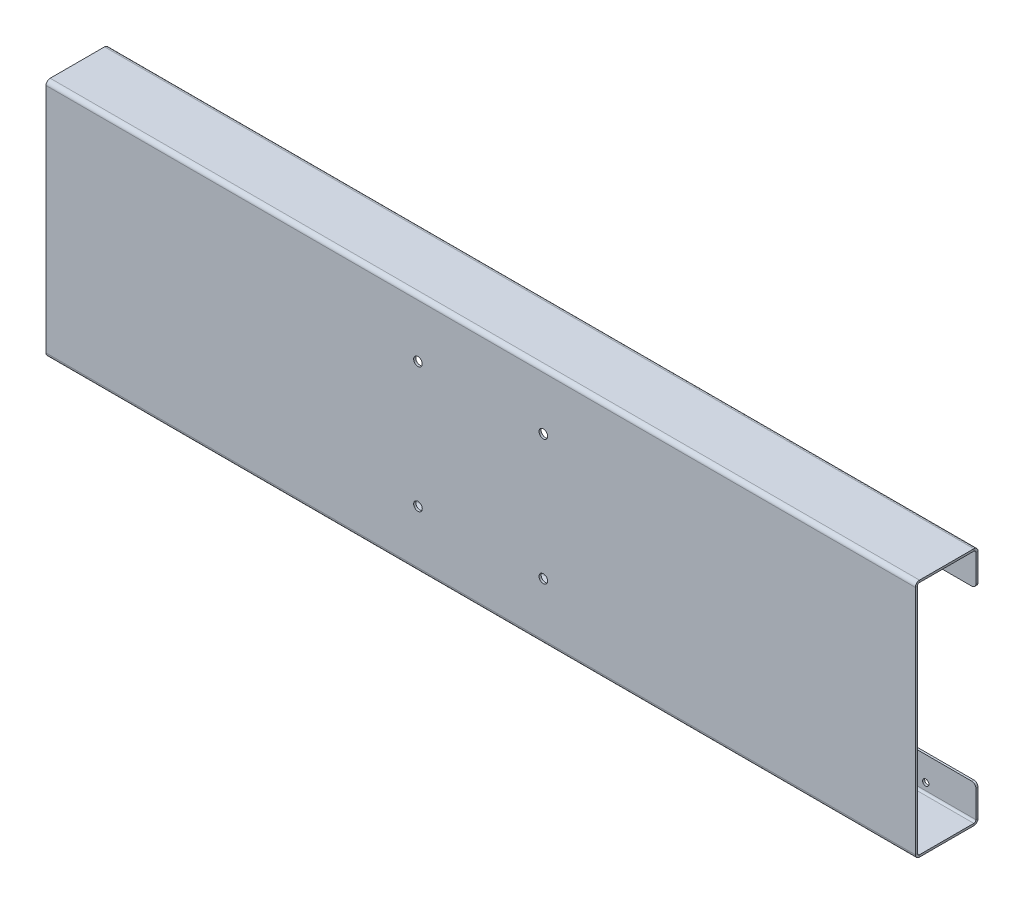
from build123d import *

# Parameters (mm, degrees)
SKETCH1_W                          = 660.4
SKETCH1_H                          = 179.07
BASE_FLANGE1_DEPTH                 = 1.5875
MITER_START                        = -330.2
MITER_FLANGE1_DEPTH                = 660.4
MITER_FLANGE1_2_DEPTH              = 660.4
F_3_16_0_1875_DIAMETER_HOLE1_D     = 4.7625
F_3_16_0_1875_DIAMETER_HOLE1_DEPTH = 5.1054
F_3_16_0_1875_DIAMETER_HOLE1_TIP   = 1.430799349
SKETCH25_R                         = 3.2639
CUT_EXTRUDE1_DEPTH                 = 346.837375989
FILLET1_R                          = 3.175


# Read off the part's stored shape, not the designer's step: Miter Flange1
# Sheet-metal steps are written as plain solids
with BuildPart() as part:
    # Sketch1 → Base-Flange1 (new body)
    with BuildSketch(Plane.XY):
        Rectangle(SKETCH1_W, SKETCH1_H)
    extrude(amount=-BASE_FLANGE1_DEPTH)

    # Miter Flange1 outline → Miter Flange1 (cut)
    with BuildSketch(Plane.YZ.offset(MITER_START)):
        with BuildLine():
            ThreePointArc((87.9475, 0), (88.769250468, -0.108185502), (89.535, -0.425369343))
            Line((89.535, -0.425369343), (89.535, 0))
            Line((89.535, 0), (87.9475, 0))
        make_face()
    miter_flange1 = extrude(amount=MITER_FLANGE1_DEPTH, mode=Mode.SUBTRACT)

    # Miter Flange1 2 outline → Miter Flange1 2 (add)
    with BuildSketch(Plane.YZ.offset(MITER_START)):
        with BuildLine():
            Line((87.9475, -46.0375), (64.135, -46.0375))
            Line((64.135, -46.0375), (64.135, -47.625))
            Line((64.135, -47.625), (87.9475, -47.625))
            ThreePointArc((87.9475, -47.625), (90.19256403, -46.69506403), (91.1225, -44.45))
            Line((91.1225, -44.45), (91.1225, -3.175))
            ThreePointArc((91.1225, -3.175), (90.697130657, -1.5875), (89.535, -0.425369343))
            Line((89.535, -0.425369343), (89.535, -1.5875))
            Line((89.535, -1.5875), (87.9475, -1.5875))
            ThreePointArc((87.9475, -1.5875), (89.070032015, -2.052467985), (89.535, -3.175))
            Line((89.535, -3.175), (89.535, -44.45))
            ThreePointArc((89.535, -44.45), (89.070032015, -45.572532015), (87.9475, -46.0375))
        make_face()
    miter_flange1_2 = extrude(amount=MITER_FLANGE1_2_DEPTH)

    # Mirror1: Miter Flange1, Miter Flange1 2 across plane
    add(miter_flange1.mirror(Plane.ZX), mode=Mode.SUBTRACT)
    add(miter_flange1_2.mirror(Plane.ZX))

    # 3/16 (0.1875) Diameter Hole1
    with Locations(Plane(origin=(0, 0, -47.625), x_dir=(-1, 0, 0), z_dir=(0, 0, -1))):
        with Locations((-292.1, 82.55), (-292.1, -82.55), (-97.366666667, 82.55), (-97.366666667, -82.55), (97.366666667, 82.55), (97.366666667, -82.55), (292.1, -82.55), (292.1, 82.55)):
            Hole(F_3_16_0_1875_DIAMETER_HOLE1_D / 2, depth=F_3_16_0_1875_DIAMETER_HOLE1_DEPTH)
            with Locations((0, 0, -(F_3_16_0_1875_DIAMETER_HOLE1_DEPTH + F_3_16_0_1875_DIAMETER_HOLE1_TIP / 2))):  # 118° drill point
                Cone(0, F_3_16_0_1875_DIAMETER_HOLE1_D / 2, F_3_16_0_1875_DIAMETER_HOLE1_TIP, mode=Mode.SUBTRACT)

    # Sketch25 → Cut-Extrude1 (cut, through all)
    with BuildSketch(Plane.XY):
        with Locations((47.625, 47.625)):
            Circle(SKETCH25_R)
        with Locations((47.625, -47.625)):
            Circle(SKETCH25_R)
        with Locations((-47.625, -47.625)):
            Circle(SKETCH25_R)
        with Locations((-47.625, 47.625)):
            Circle(SKETCH25_R)
    extrude(amount=-CUT_EXTRUDE1_DEPTH, mode=Mode.SUBTRACT)

    # Fillet1
    fillet1_edges = [part.edges().sort_by_distance(p)[0] for p in [
        (330.2, 64.135, -46.83125),
        (-330.2, 64.135, -46.83125),
        (330.2, -64.135, -46.83125),
        (-330.2, -64.135, -46.83125),
    ]]
    fillet(fillet1_edges, radius=FILLET1_R)


solid = part.part
